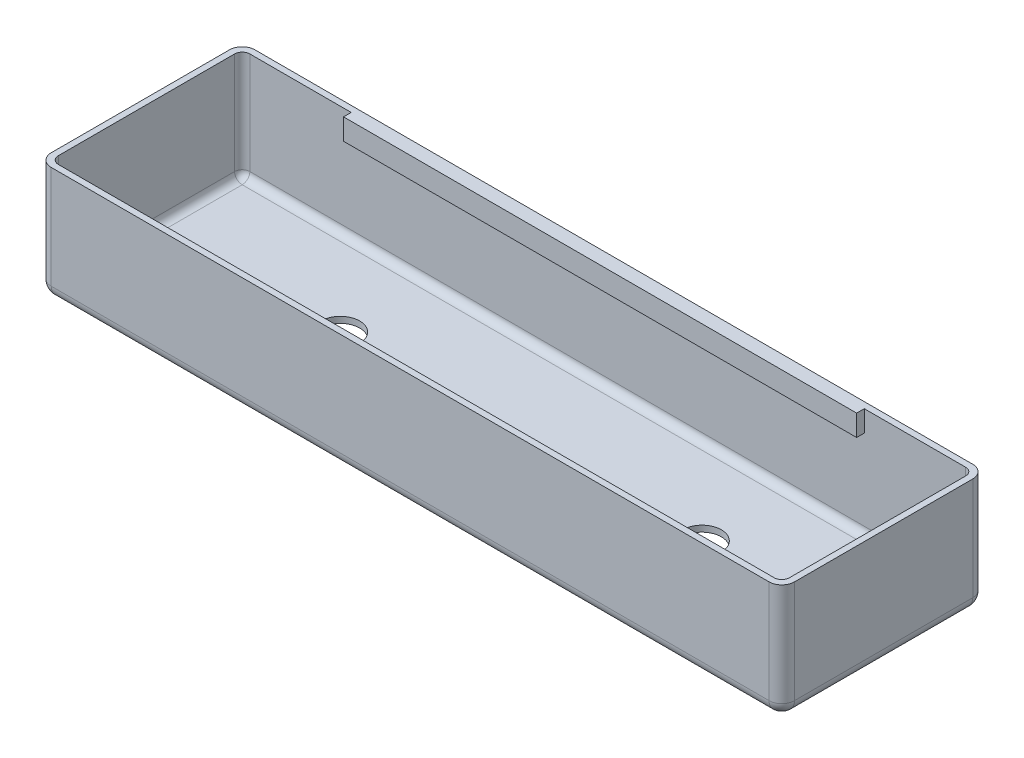
from build123d import *

# Parameters (mm, degrees)
SKETCH1_W               = 185.3692
SKETCH1_H               = 50.8
SKETCH1_W_2             = 182.3212
SKETCH1_H_2             = 47.752
BOSS_EXTRUDE1_DEPTH     = 27.305
SKETCH2_W               = 185.3692
SKETCH2_H               = 50.8
BOSS_EXTRUDE2_DEPTH     = 1.524
FILLET1_R               = 1.905
FILLET2_R               = 3.175
CUT_EXTRUDE1_DEPTH      = 2.54
CUT_EXTRUDE1_DEPTH_BACK = 101.332977222
SKETCH3_R               = 4.826
SKETCH5_W               = 127.961813322
SKETCH5_H               = 5.274349215
BOSS_EXTRUDE3_DEPTH     = 1.905


with BuildPart() as part:
    # Sketch1 → Boss-Extrude1 (new body)
    with BuildSketch(Plane(origin=(0, 0, 0), x_dir=(1, 0, 0), z_dir=(0, 1, 0))):
        Rectangle(SKETCH1_W, SKETCH1_H)
        Rectangle(SKETCH1_W_2, SKETCH1_H_2, mode=Mode.SUBTRACT)
    extrude(amount=BOSS_EXTRUDE1_DEPTH)

    # Sketch2 → Boss-Extrude2 (add)
    with BuildSketch(Plane.XZ):
        Rectangle(SKETCH2_W, SKETCH2_H)
    extrude(amount=BOSS_EXTRUDE2_DEPTH)

    # Fillet1
    fillet1_edges = [part.edges().sort_by_distance(p)[0] for p in [
        (91.1606, 13.6525, 23.876),
    ]]
    fillet(fillet1_edges, radius=FILLET1_R)
    fillet1_2_edges = [part.edges().sort_by_distance(p)[0] for p in [
        (91.1606, 0, -0.9525),
    ]]
    fillet(fillet1_2_edges, radius=FILLET1_R)
    fillet1_3_edges = [part.edges().sort_by_distance(p)[0] for p in [
        (-0.9525, 0, -23.876),
    ]]
    fillet(fillet1_3_edges, radius=FILLET1_R)
    fillet1_4_edges = [part.edges().sort_by_distance(p)[0] for p in [
        (-91.1606, 0, 0),
    ]]
    fillet(fillet1_4_edges, radius=FILLET1_R)

    # Fillet2
    fillet2_edges = [part.edges().sort_by_distance(p)[0] for p in [
        (-92.6846, -1.524, 0),
        (0, -1.524, 25.4),
        (92.6846, -1.524, 0),
        (0, -1.524, -25.4),
        (-92.6846, 12.8905, -25.4),
        (92.6846, 12.8905, -25.4),
        (92.6846, 12.8905, 25.4),
        (-92.6846, 12.8905, 25.4),
    ]]
    fillet(fillet2_edges, radius=FILLET2_R)

    # Sketch3 → Cut-Extrude1 (cut, two sides: drawn at the far end of the back side and taken through both)
    with BuildSketch(Plane.XZ.offset(1.524).offset(-CUT_EXTRUDE1_DEPTH_BACK)):
        with Locations((45, -2.3792)):
            Circle(SKETCH3_R)
        with Locations((-45.2, -2.3792)):
            Circle(SKETCH3_R)
    extrude(amount=CUT_EXTRUDE1_DEPTH + CUT_EXTRUDE1_DEPTH_BACK, mode=Mode.SUBTRACT)

    # Sketch5 → Boss-Extrude3 (add)
    with BuildSketch(Plane.XY.offset(-23.876)):
        with Locations((0, 24.667825393)):
            Rectangle(SKETCH5_W, SKETCH5_H)
    extrude(amount=BOSS_EXTRUDE3_DEPTH)


solid = part.part
